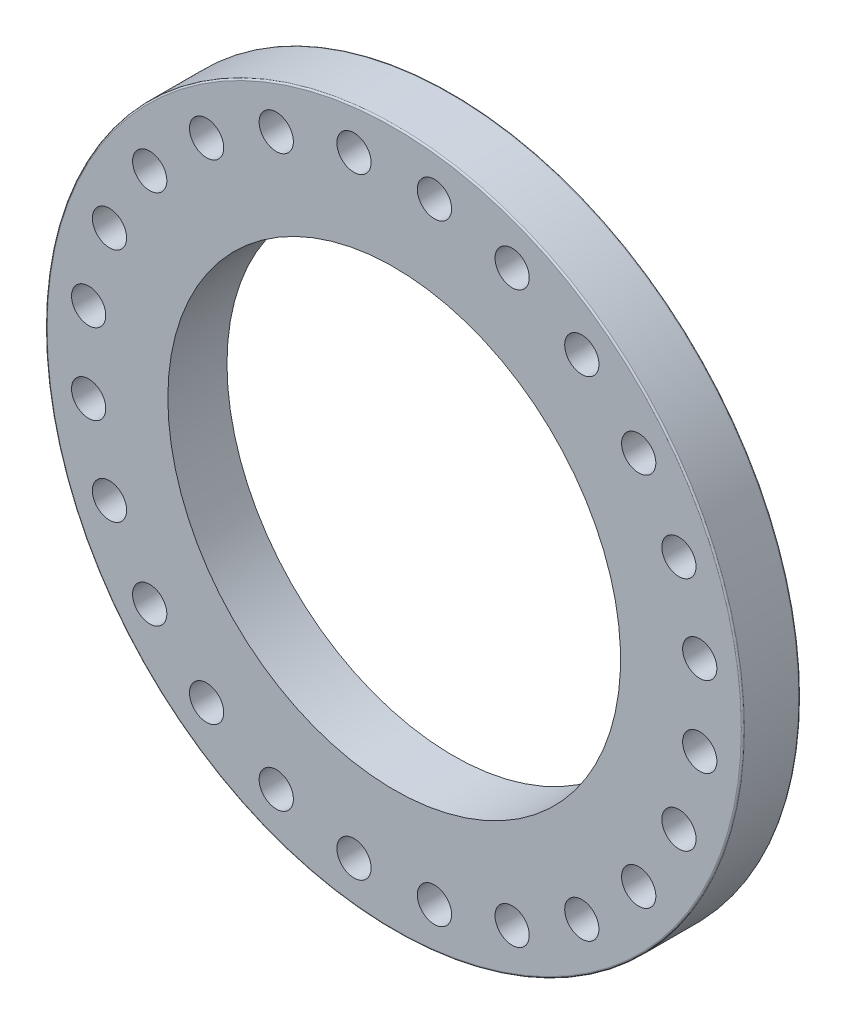
from build123d import *

# Parameters (mm, degrees)
SKETCH1_R             = 355.6
BOSS_EXTRUDE1_DEPTH   = 60.325
SKETCH2_R             = 17.4625
BOLTHOLE_DEPTH        = 507.499581071
BOLTHOLEPATTERN_COUNT = 24
SKETCH5_OUTSIDE_W     = 914.72
SKETCH5_OUTSIDE_H     = 914.72
SKETCH5_OUTSIDE_R     = 266.7
RAISED_FACE_DEPTH     = 1.5875
FILLET2_R             = 1.5875
FILLET3_R             = 1.5875
SKETCH11_R            = 230.886
CUT_EXTRUDE5_DEPTH    = 507.499581211


with BuildPart() as part:
    # Sketch1 → Boss-Extrude1 (new body)
    with BuildSketch(Plane.XY):
        with Locations(Location((0, 0, 0), (0, 0, 180))):
            Circle(SKETCH1_R)
    extrude(amount=BOSS_EXTRUDE1_DEPTH)

    # Sketch2 → BoltHole (cut, through all)
    with BuildSketch(Plane.XY):
        with Locations(Location((41.02764537, 311.635906051, 0), (0, 0, 180))):
            Circle(SKETCH2_R)
    bolthole = extrude(amount=BOLTHOLE_DEPTH, mode=Mode.SUBTRACT)

    # BoltHolePattern: BoltHole ×24 about axis
    boltholepattern_axis = Axis((0, 0, 0), (0, 0, 1))
    for i in range(1, BOLTHOLEPATTERN_COUNT):
        add(bolthole.rotate(boltholepattern_axis, i * 360 / BOLTHOLEPATTERN_COUNT), mode=Mode.SUBTRACT)

    # Sketch5 outside → Raised Face (cut)
    with BuildSketch(Plane(origin=(0, 0, 0), x_dir=(-1, 0, 0), z_dir=(0, 0, -1))):
        Rectangle(SKETCH5_OUTSIDE_W, SKETCH5_OUTSIDE_H)
        Circle(SKETCH5_OUTSIDE_R, mode=Mode.SUBTRACT)
    extrude(amount=-RAISED_FACE_DEPTH, mode=Mode.SUBTRACT)

    # Fillet2
    fillet2_edges = [part.edges().sort_by_distance(p)[0] for p in [
        (355.6, 0, 1.5875),
        (355.6, 0, 60.325),
    ]]
    fillet(fillet2_edges, radius=FILLET2_R)

    # Fillet3
    fillet3_edges = [part.edges().sort_by_distance(p)[0] for p in [
        (266.7, 0, 1.5875),
    ]]
    fillet(fillet3_edges, radius=FILLET3_R - 0.0001)  # a hair under: the kernel refuses the full size

    # Sketch11 → Cut-Extrude5 (cut, through all)
    with BuildSketch(Plane.XY):
        with Locations(Location((0, 0, 0), (0, 0, 180))):
            Circle(SKETCH11_R)
    extrude(amount=CUT_EXTRUDE5_DEPTH, mode=Mode.SUBTRACT)


solid = part.part
